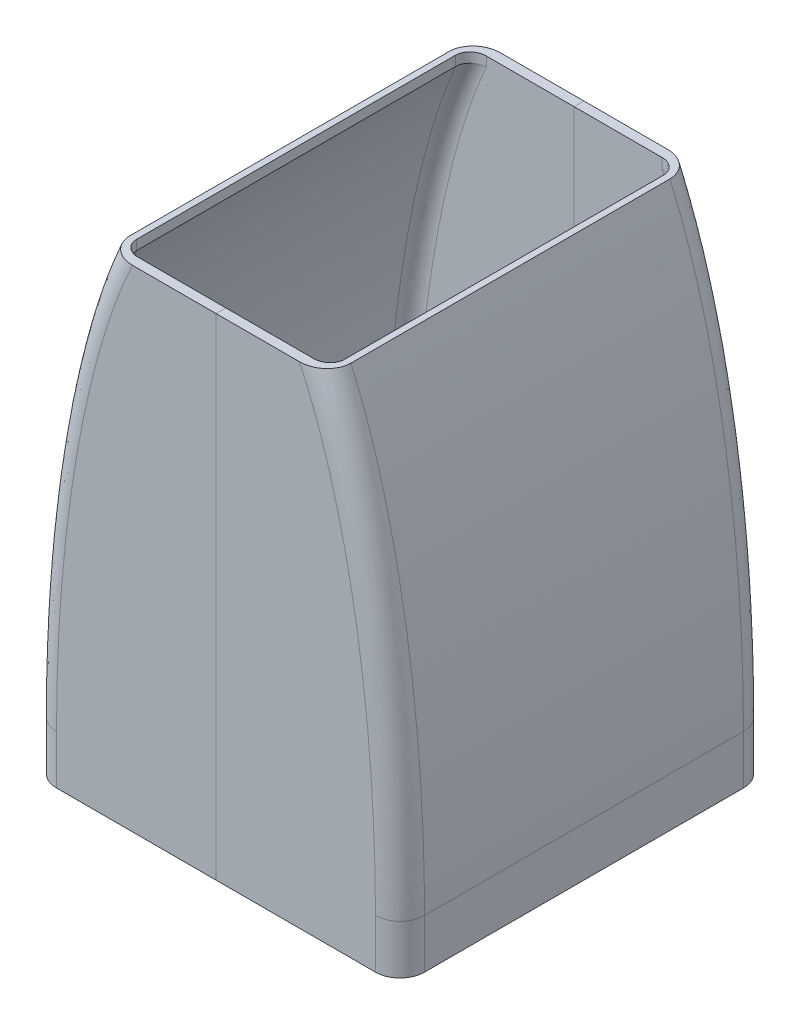
from build123d import *

# Parameters (mm, degrees)
SKETCH1_W           = 75
SKETCH1_H           = 75
BOSS_EXTRUDE1_DEPTH = 10
BOSS_EXTRUDE2_DEPTH = 75
FILLET3_R           = 5
SHELL2_T            = -2
CUT_EXTRUDE3_REACH  = 113.429


with BuildPart() as part:
    # Sketch1 → Boss-Extrude1 (new body)
    with BuildSketch(Plane(origin=(0, 0, 0), x_dir=(1, 0, 0), z_dir=(0, 1, 0))):
        Rectangle(SKETCH1_W, SKETCH1_H)
    extrude(amount=BOSS_EXTRUDE1_DEPTH)

    # Sketch2 → Boss-Extrude2 (add)
    with BuildSketch(Plane.XY.offset(37.5)):
        with BuildLine():
            Line((-22.5, 100), (22.5, 100))
            add(Edge.make_bspline(
                [(37.5, 10), (37.5, 66.25), (22.5, 100)],
                knots=[4.71238898, 4.71238898, 4.71238898, 5.639684198, 5.639684198, 5.639684198], degree=2, weights=[1, 0.894427191, 1]))
            Line((37.5, 10), (-37.5, 10))
            add(Edge.make_bspline(
                [(-22.5, 100), (-37.5, 66.25), (-37.5, 10)],
                knots=[0.643501109, 0.643501109, 0.643501109, 1.570796327, 1.570796327, 1.570796327], degree=2, weights=[1, 0.894427191, 1]))
        make_face()
    extrude(amount=-BOSS_EXTRUDE2_DEPTH)

    # Fillet3
    fillet3_edges = [part.edges().sort_by_distance(p)[0] for p in [
        (37.5, 5, 37.5),
        (34.258205029, 55.756185303, 37.5),
        (37.5, 5, -37.5),
        (34.258205029, 55.756185303, -37.5),
        (-34.25820513, 55.756184627, -37.5),
        (-37.5, 5, -37.5),
        (-37.5, 5, 37.5),
        (-34.25820513, 55.756184627, 37.5),
    ]]
    fillet(fillet3_edges, radius=FILLET3_R)

    # Shell2
    shell2_openings = [part.faces().sort_by_distance(p)[0] for p in [
        (0, 0, 0),
    ]]
    offset(amount=SHELL2_T, openings=shell2_openings)

    # Sketch5 → Cut-Extrude3 (cut, up to next)
    with BuildSketch(Plane.XZ.offset(-98), mode=Mode.PRIVATE) as cut_extrude3_sk1:
        with BuildLine():
            Line((17.917294399, 35.5), (-17.917294399, 35.5))
            add(Edge.make_bspline(
                [(-17.917294399, 35.5), (-18.124222815, 35.5), (-18.328677821, 35.482285172), (-18.732715216, 35.411957333), (-18.933933955, 35.358612811), (-19.31973595, 35.218423082), (-19.505005381, 35.131812323), (-19.859599984, 34.924084957), (-20.028599435, 34.802588021), (-20.336223508, 34.532488002), (-20.477321014, 34.38214312), (-20.727510246, 34.053163112), (-20.833968237, 33.878327262), (-21.008862259, 33.507548234), (-21.077229036, 33.309892569), (-21.167462917, 32.910766242), (-21.190604125, 32.707390506), (-21.190604125, 32.5)],
                knots=[0, 0, 0, 0, 0.125, 0.125, 0.25, 0.25, 0.375, 0.375, 0.5, 0.5, 0.625, 0.625, 0.75, 0.75, 0.875, 0.875, 1, 1, 1, 1], degree=3))
            Line((-21.190604125, 32.5), (-21.190604125, -32.5))
            add(Edge.make_bspline(
                [(-21.190604125, -32.5), (-21.190604125, -32.707794994), (-21.166761391, -32.915802031), (-21.075329764, -33.316304706), (-21.008238688, -33.509285708), (-20.83246189, -33.881100188), (-20.723307159, -34.059237571), (-20.475535917, -34.383929257), (-20.33582844, -34.533047267), (-20.025299502, -34.805270496), (-19.857003505, -34.925726081), (-19.504683606, -35.13187976), (-19.31939744, -35.218670428), (-18.736180726, -35.430220381), (-18.331689323, -35.5), (-17.917294399, -35.5)],
                knots=[0, 0, 0, 0, 0.125, 0.125, 0.25, 0.25, 0.375, 0.375, 0.5, 0.5, 0.625, 0.625, 0.75, 0.75, 1, 1, 1, 1], degree=3))
            Line((-17.917294399, -35.5), (17.917294399, -35.5))
            add(Edge.make_bspline(
                [(17.917294399, -35.5), (18.124222815, -35.5), (18.328677821, -35.482285172), (18.732715216, -35.411957333), (18.933933955, -35.358612811), (19.31973595, -35.218423082), (19.505005381, -35.131812323), (19.859599984, -34.924084957), (20.028599435, -34.802588021), (20.336223508, -34.532488002), (20.477321014, -34.38214312), (20.727510246, -34.053163112), (20.833968237, -33.878327262), (21.008862259, -33.507548234), (21.077229036, -33.309892569), (21.167462917, -32.910766242), (21.190604125, -32.707390506), (21.190604125, -32.5)],
                knots=[0, 0, 0, 0, 0.125, 0.125, 0.25, 0.25, 0.375, 0.375, 0.5, 0.5, 0.625, 0.625, 0.75, 0.75, 0.875, 0.875, 1, 1, 1, 1], degree=3))
            Line((21.190604125, -32.5), (21.190604125, 32.5))
            add(Edge.make_bspline(
                [(21.190604125, 32.5), (21.190604125, 32.707794994), (21.166761391, 32.915802031), (21.075329764, 33.316304706), (21.008238688, 33.509285708), (20.83246189, 33.881100188), (20.723307159, 34.059237571), (20.475535917, 34.383929257), (20.33582844, 34.533047267), (20.025299502, 34.805270496), (19.857003505, 34.925726081), (19.504683606, 35.13187976), (19.31939744, 35.218670428), (18.736180726, 35.430220381), (18.331689323, 35.5), (17.917294399, 35.5)],
                knots=[0, 0, 0, 0, 0.125, 0.125, 0.25, 0.25, 0.375, 0.375, 0.5, 0.5, 0.625, 0.625, 0.75, 0.75, 1, 1, 1, 1], degree=3))
        make_face()
    cut_extrude3_tool1 = extrude(cut_extrude3_sk1.sketch, amount=-CUT_EXTRUDE3_REACH, mode=Mode.PRIVATE) & part.part
    add(cut_extrude3_tool1.solids().sort_by_distance((0, 98, -4.5e-05))[0], mode=Mode.SUBTRACT)


with BuildPart() as body_2:
    # Split1: the piece on the far side of the plane
    add(part.part)
    split(bisect_by=Plane(origin=(0, 0, 0), x_dir=(0, 0, 1), z_dir=(1, 0, 0)), keep=Keep.BOTTOM)


with BuildPart() as part_1:
    add(part.part)

    # Split1
    split(bisect_by=Plane(origin=(0, 0, 0), x_dir=(0, 0, 1), z_dir=(1, 0, 0)), keep=Keep.TOP)


solid = Compound([body_2.part, part_1.part])
